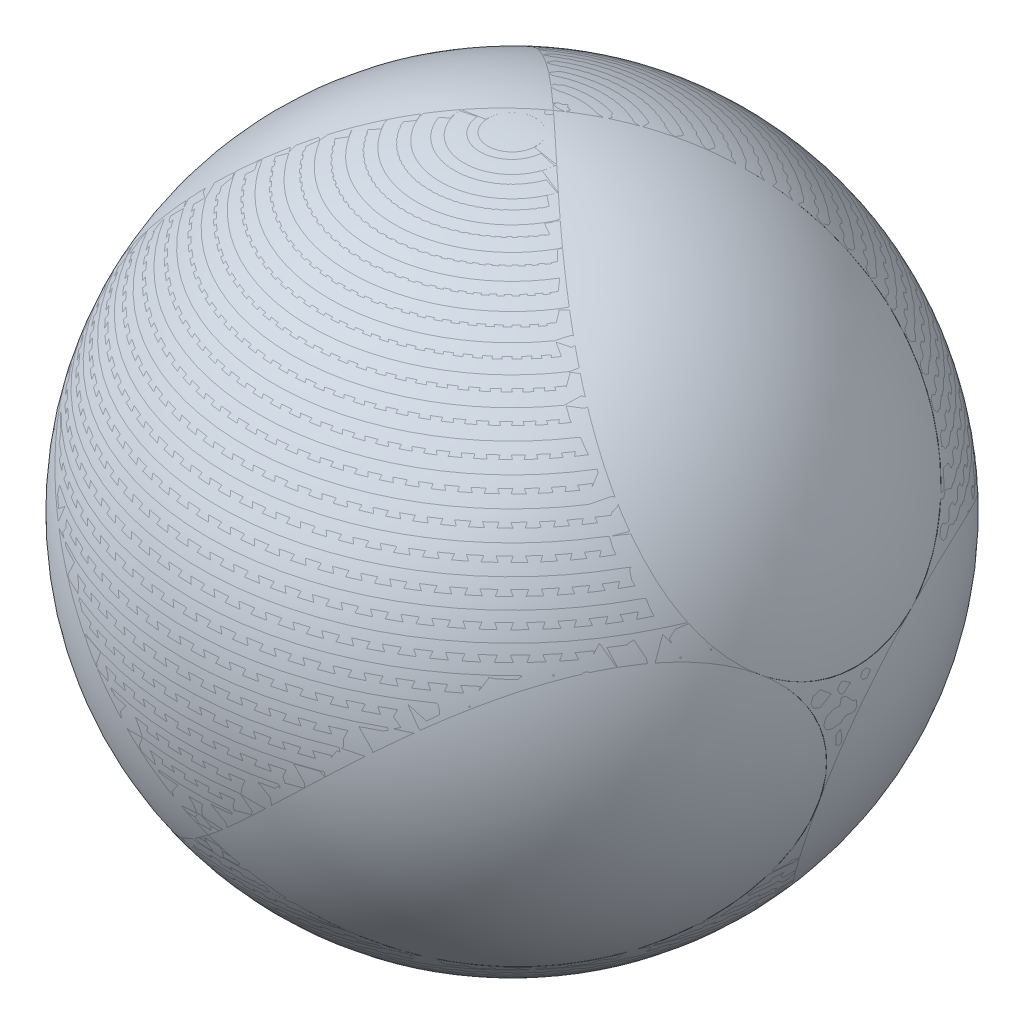
from build123d import *

# Parameters (mm, degrees)
EXTRUDE_2_REACH                  = 53.962
EXTRUDE_2_END_RADIUS             = 30
EXTRUDE_2_DIRECTION_2_REACH      = 53.962
EXTRUDE_2_DIRECTION_2_END_RADIUS = 30


with BuildPart() as part:
    # 草图3 → 旋转11 (revolve)
    with BuildSketch(Plane.XY):
        with BuildLine():
            Line((0, 30), (0, -30))
            ThreePointArc((0, -30), (30, 0), (0, 30))
        make_face()
    revolve(axis=Axis((0, 30, 0), (0, -1, 0)))


with BuildPart() as body_2:
    # 凸台-拉伸2: up to this sphere (the profile starts inside it)
    extrude_2_end = Location((0, 0, 0)) * Sphere(EXTRUDE_2_END_RADIUS, mode=Mode.PRIVATE)
    # 草图6 → 凸台-拉伸2 (new, up to the surface)
    with BuildSketch(Plane(origin=(0, 0, 0), x_dir=(0, 0, -1), z_dir=(1, 0, 0)), mode=Mode.PRIVATE) as extrude_2_sk1:
        with BuildLine():
            ThreePointArc((23.892221697602384, -18.142815171649023), (27.65824959496046, 11.619863568169357), (3.7660275318599545, 29.762678586264254))
            ThreePointArc((3.766027531859952, 29.762678586264258), (15.812820849000335, 17.83655076640968), (7.411005407110825, 3.113533029483781))
            ThreePointArc((7.411005407110819, 3.1135330294837793), (23.806898583847133, -1.1913998801314563), (23.89222169760238, -18.142815171649026))
        make_face()
    extrude_2_tool1 = extrude(extrude_2_sk1.sketch, amount=-EXTRUDE_2_REACH, mode=Mode.PRIVATE) & extrude_2_end
    add(extrude_2_tool1.solids().sort_by_distance((0, 9.053929, -21.550668))[0])
    # 草图6 → 凸台-拉伸2 (new, up to the surface)
    with BuildSketch(Plane(origin=(0, 0, 0), x_dir=(0, 0, -1), z_dir=(1, 0, 0)), mode=Mode.PRIVATE) as extrude_2_sk2:
        with BuildLine():
            ThreePointArc((-6.4019014252170185, 4.861352452566587), (-10.871666810824422, 21.213078700234668), (3.766027531859952, 29.762678586264258))
            ThreePointArc((3.766027531859952, 29.762678586264258), (-23.892221949417106, 18.142814840034927), (-27.65824953836626, -11.619863702878044))
            ThreePointArc((-27.658249538366263, -11.619863702878025), (-23.353316482611287, 4.776029194184393), (-6.401901425217019, 4.861352452566588))
        make_face()
    extrude_2_tool2 = extrude(extrude_2_sk2.sketch, amount=-EXTRUDE_2_REACH, mode=Mode.PRIVATE) & extrude_2_end
    add(extrude_2_tool2.solids().sort_by_distance((0, 14.136461, 18.616266))[0])
    # 草图6 → 凸台-拉伸2 (new, up to the surface)
    with BuildSketch(Plane(origin=(0, 0, 0), x_dir=(0, 0, -1), z_dir=(1, 0, 0)), mode=Mode.PRIVATE) as extrude_2_sk3:
        with BuildLine():
            ThreePointArc((-27.658249538366263, -11.619863702878032), (-3.766027799995323, -29.762678552335682), (23.892221697602384, -18.142815171649023))
            ThreePointArc((23.892221697602384, -18.142815171649026), (7.540495407708942, -22.61257984291386), (-1.0091039948758294, -7.974885388820282))
            ThreePointArc((-1.0091039948758276, -7.974885388820292), (-12.935231630430888, -20.021678988261602), (-27.658249538366263, -11.619863702878032))
        make_face()
    extrude_2_tool3 = extrude(extrude_2_sk3.sketch, amount=-EXTRUDE_2_REACH, mode=Mode.PRIVATE) & extrude_2_end
    add(extrude_2_tool3.solids().sort_by_distance((0, -23.19039, 2.934401))[0])
    # 草图6 → 凸台-拉伸2 (new, up to the surface)
    with BuildSketch(Plane(origin=(0, 0, 0), x_dir=(0, 0, -1), z_dir=(1, 0, 0)), mode=Mode.PRIVATE) as extrude_2_sk4:
        with BuildLine():
            ThreePointArc((7.411005407110819, 3.1135330294837793), (0.27038859670814386, 2.136864182711342), (-6.4019014252170185, 4.861352452566587))
            ThreePointArc((-6.401901425217018, 4.861352452566588), (-1.985772990862067, -0.8342686362000489), (-1.0091039948758258, -7.974885388820288))
            ThreePointArc((-1.0091039948758294, -7.974885388820282), (1.7153843829111537, -1.3025954657716703), (7.411005407110819, 3.1135330294837793))
        make_face()
    extrude_2_tool4 = extrude(extrude_2_sk4.sketch, amount=-EXTRUDE_2_REACH, mode=Mode.PRIVATE) & extrude_2_end
    add(extrude_2_tool4.solids().sort_by_distance((0, 0, 0))[0])

    # 凸台-拉伸2 direction 2: up to this sphere (the profile starts inside it)
    extrude_2_direction_2_end = Location((0, 0, 0)) * Sphere(EXTRUDE_2_DIRECTION_2_END_RADIUS, mode=Mode.PRIVATE)
    # 草图6 → 凸台-拉伸2 direction 2 (add, up to the surface)
    with BuildSketch(Plane(origin=(0, 0, 0), x_dir=(0, 0, -1), z_dir=(1, 0, 0)), mode=Mode.PRIVATE) as extrude_2_direction_2_sk1:
        with BuildLine():
            ThreePointArc((23.892221697602384, -18.142815171649023), (27.65824959496046, 11.619863568169357), (3.7660275318599545, 29.762678586264254))
            ThreePointArc((3.766027531859952, 29.762678586264258), (15.812820849000335, 17.83655076640968), (7.411005407110825, 3.113533029483781))
            ThreePointArc((7.411005407110819, 3.1135330294837793), (23.806898583847133, -1.1913998801314563), (23.89222169760238, -18.142815171649026))
        make_face()
    extrude_2_direction_2_tool1 = extrude(extrude_2_direction_2_sk1.sketch, amount=EXTRUDE_2_DIRECTION_2_REACH, mode=Mode.PRIVATE) & extrude_2_direction_2_end
    add(extrude_2_direction_2_tool1.solids().sort_by_distance((0, 9.053929, -21.550668))[0])
    # 草图6 → 凸台-拉伸2 direction 2 (add, up to the surface)
    with BuildSketch(Plane(origin=(0, 0, 0), x_dir=(0, 0, -1), z_dir=(1, 0, 0)), mode=Mode.PRIVATE) as extrude_2_direction_2_sk2:
        with BuildLine():
            ThreePointArc((-6.4019014252170185, 4.861352452566587), (-10.871666810824422, 21.213078700234668), (3.766027531859952, 29.762678586264258))
            ThreePointArc((3.766027531859952, 29.762678586264258), (-23.892221949417106, 18.142814840034927), (-27.65824953836626, -11.619863702878044))
            ThreePointArc((-27.658249538366263, -11.619863702878025), (-23.353316482611287, 4.776029194184393), (-6.401901425217019, 4.861352452566588))
        make_face()
    extrude_2_direction_2_tool2 = extrude(extrude_2_direction_2_sk2.sketch, amount=EXTRUDE_2_DIRECTION_2_REACH, mode=Mode.PRIVATE) & extrude_2_direction_2_end
    add(extrude_2_direction_2_tool2.solids().sort_by_distance((0, 14.136461, 18.616266))[0])
    # 草图6 → 凸台-拉伸2 direction 2 (add, up to the surface)
    with BuildSketch(Plane(origin=(0, 0, 0), x_dir=(0, 0, -1), z_dir=(1, 0, 0)), mode=Mode.PRIVATE) as extrude_2_direction_2_sk3:
        with BuildLine():
            ThreePointArc((-27.658249538366263, -11.619863702878032), (-3.766027799995323, -29.762678552335682), (23.892221697602384, -18.142815171649023))
            ThreePointArc((23.892221697602384, -18.142815171649026), (7.540495407708942, -22.61257984291386), (-1.0091039948758294, -7.974885388820282))
            ThreePointArc((-1.0091039948758276, -7.974885388820292), (-12.935231630430888, -20.021678988261602), (-27.658249538366263, -11.619863702878032))
        make_face()
    extrude_2_direction_2_tool3 = extrude(extrude_2_direction_2_sk3.sketch, amount=EXTRUDE_2_DIRECTION_2_REACH, mode=Mode.PRIVATE) & extrude_2_direction_2_end
    add(extrude_2_direction_2_tool3.solids().sort_by_distance((0, -23.19039, 2.934401))[0])
    # 草图6 → 凸台-拉伸2 direction 2 (add, up to the surface)
    with BuildSketch(Plane(origin=(0, 0, 0), x_dir=(0, 0, -1), z_dir=(1, 0, 0)), mode=Mode.PRIVATE) as extrude_2_direction_2_sk4:
        with BuildLine():
            ThreePointArc((7.411005407110819, 3.1135330294837793), (0.27038859670814386, 2.136864182711342), (-6.4019014252170185, 4.861352452566587))
            ThreePointArc((-6.401901425217018, 4.861352452566588), (-1.985772990862067, -0.8342686362000489), (-1.0091039948758258, -7.974885388820288))
            ThreePointArc((-1.0091039948758294, -7.974885388820282), (1.7153843829111537, -1.3025954657716703), (7.411005407110819, 3.1135330294837793))
        make_face()
    extrude_2_direction_2_tool4 = extrude(extrude_2_direction_2_sk4.sketch, amount=EXTRUDE_2_DIRECTION_2_REACH, mode=Mode.PRIVATE) & extrude_2_direction_2_end
    add(extrude_2_direction_2_tool4.solids().sort_by_distance((0, 0, 0))[0])


solid = Compound([part.part, body_2.part])
